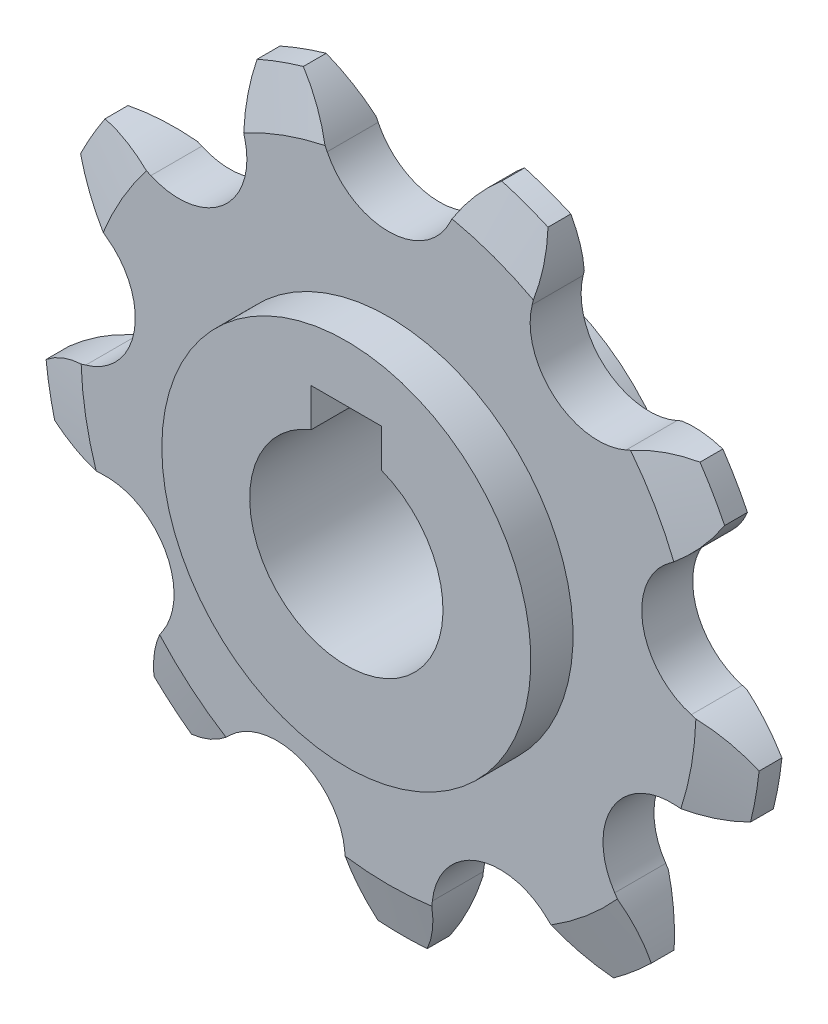
from build123d import *

# Parameters (mm, degrees)
ESQUISSE2_W                  = 4
ESQUISSE2_H                  = 7.3
ENL_V_MAT_EXTRU_1_DEPTH      = 31.221184623
ENL_V_MAT_EXTRU_2_DEPTH      = 30.306014741
R_P_TITION_CIRCULAIRE1_COUNT = 9


with BuildPart() as part:
    # Esquisse1 → Révolution1 (revolve)
    with BuildSketch(Plane(origin=(0, 0, 0), x_dir=(0, 0, -1), z_dir=(1, 0, 0))):
        Polygon((-5.8, 20.4), (-6.6, 17.5), (-6.6, 10.5), (-9, 10.5), (-9, 5.5), (0, 5.5), (0, 10.5), (-3.7, 10.5), (-3.7, 17.5), (-4.5, 20.4), align=None)
    revolve(axis=Axis((0, 0, 0), (0, 0, 1)))

    # Esquisse2 → Enlèv. mat.-Extru.1 (cut, through all)
    with BuildSketch(Plane.XY):
        with Locations((0, 3.65)):
            Rectangle(ESQUISSE2_W, ESQUISSE2_H)
    extrude(amount=ENL_V_MAT_EXTRU_1_DEPTH, mode=Mode.SUBTRACT)

    # Esquisse4 → Enlèv. mat.-Extru.2 (cut, symmetric)
    with BuildSketch(Plane.XY.offset(5.15)):
        with BuildLine():
            ThreePointArc((-3.488153141, 16.878433832), (0, 14.691157941), (3.488153141, 16.878433832))
            ThreePointArc((3.488153141, 16.878433832), (4.416914632, 18.359445416), (5.645191484, 19.603362291))
            ThreePointArc((5.645191484, 19.603362291), (0, 20.4), (-5.645191484, 19.603362291))
            ThreePointArc((-5.645191484, 19.603362291), (-4.416914632, 18.359445416), (-3.488153141, 16.878433832))
        make_face()
    enl_v_mat_extru_2 = extrude(amount=ENL_V_MAT_EXTRU_2_DEPTH, both=True, mode=Mode.SUBTRACT)

    # Répétition circulaire1: Enlèv. mat.-Extru.2 ×9 about axis
    r_p_tition_circulaire1_axis = Axis((0, 0, 0), (0, 0, 1))
    for i in range(1, R_P_TITION_CIRCULAIRE1_COUNT):
        add(enl_v_mat_extru_2.rotate(r_p_tition_circulaire1_axis, i * 360 / R_P_TITION_CIRCULAIRE1_COUNT), mode=Mode.SUBTRACT)


solid = part.part
